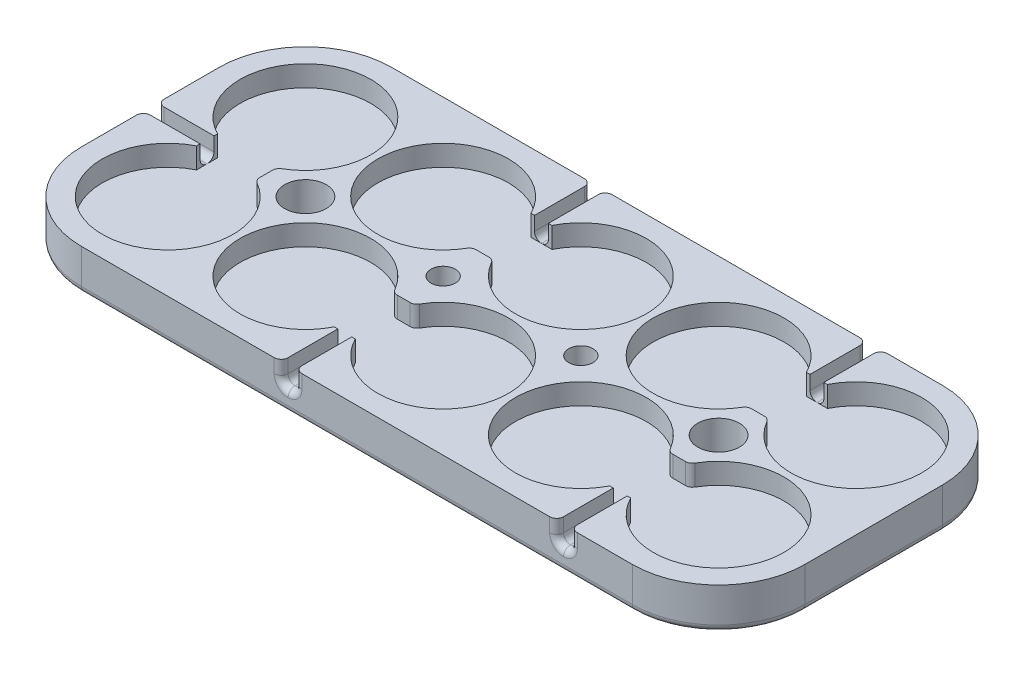
from build123d import *

# Parameters (mm, degrees)
SKETCH2_R               = 9.425
BOSS_EXTRUDE1_DEPTH     = 3
BOSS_EXTRUDE2_START     = -3
SKETCH3_R               = 12.425
BOSS_EXTRUDE2_DEPTH     = 3
SKETCH4_W               = 19.85
SKETCH4_H               = 8.5
SKETCH4_W_2             = 8.5
SKETCH4_H_2             = 19.85
CUT_EXTRUDE1_DEPTH      = 57.793821187
SKETCH5_W               = 2
SKETCH5_H               = 11.675
SKETCH5_W_2             = 11.675
SKETCH5_H_2             = 2
CUT_EXTRUDE2_DEPTH      = 57.793821187
CUT_EXTRUDE3_DEPTH      = 57.793821187
CUT_EXTRUDE3_DEPTH_BACK = 57.793821187
SKETCH7_R               = 3
SKETCH7_R_2             = 1.75
SKETCH8_R               = 3
CUT_EXTRUDE4_DEPTH      = 3.5
FILLET1_R               = 1
FILLET2_R               = 1
CUT_EXTRUDE5_DEPTH      = 0.5


with BuildPart() as part:
    # Sketch2 → Boss-Extrude1 (new body)
    with BuildSketch(Plane(origin=(0, 0, 0), x_dir=(1, 0, 0), z_dir=(0, 1, 0))):
        with BuildLine():
            Line((-39.7, -22.35), (39.7, -22.35))
            ThreePointArc((39.7, -22.35), (48.485801756, -18.710801756), (52.125, -9.925))
            Line((52.125, -9.925), (52.125, 9.925))
            ThreePointArc((52.125, 9.925), (48.485801756, 18.710801756), (39.7, 22.35))
            Line((39.7, 22.35), (-39.7, 22.35))
            ThreePointArc((-39.7, 22.35), (-48.485801756, 18.710801756), (-52.125, 9.925))
            Line((-52.125, 9.925), (-52.125, -9.925))
            ThreePointArc((-52.125, -9.925), (-48.485801756, -18.710801756), (-39.7, -22.35))
        make_face()
        with Locations(Location((-19.85, 9.925, 0), (0, 0, 270))):
            Circle(SKETCH2_R, mode=Mode.SUBTRACT)
        with Locations(Location((-39.7, -9.925, 0), (0, 0, 270))):
            Circle(SKETCH2_R, mode=Mode.SUBTRACT)
        with Locations(Location((-39.7, 9.925, 0), (0, 0, 270))):
            Circle(SKETCH2_R, mode=Mode.SUBTRACT)
        with Locations(Location((-19.85, -9.925, 0), (0, 0, 270))):
            Circle(SKETCH2_R, mode=Mode.SUBTRACT)
        with Locations(Location((19.85, -9.925, 0), (0, 0, 270))):
            Circle(SKETCH2_R, mode=Mode.SUBTRACT)
        with Locations(Location((39.7, 9.925, 0), (0, 0, 270))):
            Circle(SKETCH2_R, mode=Mode.SUBTRACT)
        with Locations(Location((39.7, -9.925, 0), (0, 0, 270))):
            Circle(SKETCH2_R, mode=Mode.SUBTRACT)
        with Locations(Location((19.85, 9.925, 0), (0, 0, 270))):
            Circle(SKETCH2_R, mode=Mode.SUBTRACT)
        with Locations(Location((0, -9.925, 0), (0, 0, 270))):
            Circle(SKETCH2_R, mode=Mode.SUBTRACT)
        with Locations(Location((0, 9.925, 0), (0, 0, 270))):
            Circle(SKETCH2_R, mode=Mode.SUBTRACT)
    extrude(amount=BOSS_EXTRUDE1_DEPTH)

    # Sketch3 → Boss-Extrude2 (add)
    with BuildSketch(Plane(origin=(0, 0, 0), x_dir=(1, 0, 0), z_dir=(0, 1, 0)).offset(BOSS_EXTRUDE2_START)):
        with BuildLine():
            ThreePointArc((-27.275, -9.925), (-30.914198244, -18.710801756), (-39.7, -22.35))
            Line((-39.7, -22.35), (39.700000108, -22.35))
            ThreePointArc((39.700000108, -22.35), (27.916563549, -13.865970744), (32.225041806, 0))
            ThreePointArc((32.225041806, 0), (27.916563532, 13.865970693), (39.7, 22.35))
            Line((39.7, 22.35), (-39.7, 22.35))
            ThreePointArc((-39.7, 22.35), (-30.914198244, 18.710801756), (-27.275, 9.925))
            ThreePointArc((-27.275, 9.925), (-28.581165066, 4.379539269), (-32.225041806, 0))
            ThreePointArc((-32.225041806, 0), (-28.581165066, -4.379539269), (-27.275, -9.925))
        make_face()
        with Locations((-39.7, 9.925)):
            Circle(SKETCH3_R)
        with Locations((-39.7, -9.925)):
            Circle(SKETCH3_R)
        with BuildLine():
            Line((-52.125, 9.924999978), (-52.125, -9.925))
            ThreePointArc((-52.125, -9.925), (-50.818834934, -4.379539269), (-47.174958194, 0))
            ThreePointArc((-47.174958194, 0), (-50.818834929, 4.379539259), (-52.125, 9.924999978))
        make_face()
        with Locations((39.7, -9.925)):
            Circle(SKETCH3_R)
        with Locations((39.7, 9.925)):
            Circle(SKETCH3_R)
        with BuildLine():
            ThreePointArc((47.174958194, 0), (50.818834934, -4.379539269), (52.125, -9.925))
            Line((52.125, -9.925), (52.125, 9.925))
            ThreePointArc((52.125, 9.925), (50.818834934, 4.379539269), (47.174958194, 0))
        make_face()
    extrude(amount=BOSS_EXTRUDE2_DEPTH)

    # Sketch4 → Cut-Extrude1 (cut, through all)
    with BuildSketch(Plane(origin=(0, 0, 0), x_dir=(1, 0, 0), z_dir=(0, 1, 0))):
        with Locations((29.775, -9.925)):
            Rectangle(SKETCH4_W, SKETCH4_H)
        with Locations((-9.925, -9.925)):
            Rectangle(SKETCH4_W, SKETCH4_H)
        with Locations((-39.7, 0)):
            Rectangle(SKETCH4_W_2, SKETCH4_H_2)
        with Locations((-9.925, 9.925)):
            Rectangle(SKETCH4_W, SKETCH4_H)
        with Locations((29.775, 9.925)):
            Rectangle(SKETCH4_W, SKETCH4_H)
    extrude(amount=CUT_EXTRUDE1_DEPTH, mode=Mode.SUBTRACT)

    # Sketch5 → Cut-Extrude2 (cut, through all)
    with BuildSketch(Plane(origin=(0, 0, 0), x_dir=(1, 0, 0), z_dir=(0, 1, 0))):
        with Locations((-9.925, 16.5125)):
            Rectangle(SKETCH5_W, SKETCH5_H)
        with Locations((29.775, 16.5125)):
            Rectangle(SKETCH5_W, SKETCH5_H)
        with Locations((29.775, -16.5125)):
            Rectangle(SKETCH5_W, SKETCH5_H)
        with Locations((-9.925, -16.5125)):
            Rectangle(SKETCH5_W, SKETCH5_H)
        with Locations((-46.2875, 0)):
            Rectangle(SKETCH5_W_2, SKETCH5_H_2)
    extrude(amount=CUT_EXTRUDE2_DEPTH, mode=Mode.SUBTRACT)

    # Sketch7 → Cut-Extrude3 (cut, two sides: drawn at the far end of the back side and taken through both)
    with BuildSketch(Plane(origin=(0, 0, 0), x_dir=(1, 0, 0), z_dir=(0, 1, 0)).offset(-CUT_EXTRUDE3_DEPTH_BACK)):
        with Locations(Location((-29.775, 0, 0), (0, 0, 270))):
            Circle(SKETCH7_R)
        with Locations(Location((-9.925, 0, 0), (0, 0, 270))):
            Circle(SKETCH7_R_2)
        with Locations(Location((9.925, 0, 0), (0, 0, 270))):
            Circle(SKETCH7_R_2)
        with Locations(Location((29.775, 0, 0), (0, 0, 270))):
            Circle(SKETCH7_R)
    extrude(amount=CUT_EXTRUDE3_DEPTH + CUT_EXTRUDE3_DEPTH_BACK, mode=Mode.SUBTRACT)

    # Sketch8 → Cut-Extrude4 (cut)
    with BuildSketch(Plane.XZ.offset(3)):
        with Locations(Location((9.925, 0, 0), (0, 0, 270))):
            Circle(SKETCH8_R)
        with Locations(Location((-9.925, 0, 0), (0, 0, 270))):
            Circle(SKETCH8_R)
    extrude(amount=-CUT_EXTRUDE4_DEPTH, mode=Mode.SUBTRACT)

    # Fillet1
    fillet1_edges = [part.edges().sort_by_distance(p)[0] for p in [
        (28.775, 0, 18.2625),
        (30.775, 0, 18.2625),
        (-8.925, 0, 18.2625),
        (-10.925, 0, 18.2625),
        (-48.0375, 0, 1),
        (-48.0375, 0, -1),
        (-10.925, 0, -18.2625),
        (-8.925, 0, -18.2625),
        (28.775, 0, -18.2625),
        (30.775, 0, -18.2625),
    ]]
    fillet(fillet1_edges, radius=FILLET1_R - 0.0001)  # a hair under: the kernel refuses the full size
    fillet1_2_edges = [part.edges().sort_by_distance(p)[0] for p in [
        (28.775, 1.99995, 22.35),
        (30.775, 1.99995, 22.35),
        (-10.925, 1.99995, 22.35),
        (-8.925, 1.99995, 22.35),
        (-52.125, 1.99995, 1),
        (-52.125, 1.99995, -1),
        (-8.925, 1.99995, -22.35),
        (-10.925, 1.99995, -22.35),
        (30.775, 1.99995, -22.35),
        (28.775, 1.99995, -22.35),
        (28.262379271, 1.5, 5.675),
        (31.287620729, 1.5, 5.675),
        (-8.412379271, 1.5, 5.675),
        (-11.437620729, 1.5, 5.675),
        (-35.45, 1.5, -1.512620729),
        (-35.45, 1.5, 1.512620729),
        (-11.437620729, 1.5, -5.675),
        (-8.412379271, 1.5, -5.675),
        (28.262379271, 1.5, -5.675),
        (31.287620729, 1.5, -5.675),
        (29.067863929, 0.292863929, -22.35),
        (30.482136071, 0.292863929, -22.35),
        (-10.632136071, 0.292863929, -22.35),
        (-9.217863929, 0.292863929, -22.35),
        (-52.125, 0.292863929, -0.707136071),
        (-52.125, 0.292863929, 0.707136071),
        (-9.217863929, 0.292863929, 22.35),
        (-10.632136071, 0.292863929, 22.35),
        (30.482136071, 0.292863929, 22.35),
        (29.067863929, 0.292863929, 22.35),
    ]]
    fillet(fillet1_2_edges, radius=FILLET1_R)

    # Fillet2
    fillet2_edges = [part.edges().sort_by_distance(p)[0] for p in [
        (48.485801794, -3, 18.710801718),
        (5.4e-08, -3, 22.35),
        (-48.485801756, -3, 18.710801756),
        (-48.485801764, -3, -18.710801748),
        (48.485801756, -3, -18.710801756),
        (52.125, -3, 0),
        (-52.125, -3, 1.1e-08),
        (0, -3, -22.35),
    ]]
    fillet(fillet2_edges, radius=FILLET2_R)

    # Sketch9 → Cut-Extrude5 (cut)
    # profile 1 of 10: a face of its own
    with BuildSketch(Plane.XZ.offset(3)):
        Polygon((-41.93125, -3.371875), (-41.93125, -1.990625), (-40.30625, -1.990625), (-40.30625, -0.379589844), (-39.0875, -0.379589844), (-39.0875, -1.990625), (-37.4625, -1.990625), (-37.4625, -3.371875), (-39.0875, -3.371875), (-39.0875, -4.990527344), (-40.30625, -4.990527344), (-40.30625, -3.371875), align=None)
    # profile 2 of 10: a face of its own
    with BuildSketch(Plane.XZ.offset(3)):
        with BuildLine():
            Line((-37.70625, 1.155273438), (-37.70625, 3.003710938))
            Line((-37.70625, 3.003710938), (-38.913574219, 3.2296875))
            add(Edge.make_bspline(
                [(-38.913574219, 3.2296875), (-38.888354447, 3.195004202), (-38.838357858, 3.126246777), (-38.775816936, 3.016215044), (-38.719833196, 2.904684269), (-38.67723522, 2.78804962), (-38.642859865, 2.668424819), (-38.616912947, 2.545512106), (-38.603260829, 2.418768552), (-38.601095778, 2.333427364), (-38.6, 2.290234375)],
                knots=[0, 0, 0, 0, 1.019769699, 2.021628385, 3.008030164, 3.986378705, 4.97133988, 5.968784958, 6.971958885, 8, 8, 8, 8], degree=3))
            add(Edge.make_bspline(
                [(-38.6, 2.290234375), (-38.601776673, 2.216478332), (-38.605285814, 2.070801375), (-38.638472169, 1.856507366), (-38.690195164, 1.649702893), (-38.762963563, 1.451812524), (-38.852441456, 1.264849333), (-38.957887633, 1.090464117), (-39.076393572, 0.928545879), (-39.212214447, 0.783101653), (-39.357772298, 0.650132327), (-39.515952873, 0.534442847), (-39.684877452, 0.434760373), (-39.863331803, 0.35124336), (-40.050292843, 0.284690145), (-40.244416524, 0.238412025), (-40.444476066, 0.207371634), (-40.580350356, 0.204550731), (-40.649023437, 0.203125)],
                knots=[0, 0, 0, 0, 1.08625284, 2.145478562, 3.187603353, 4.223364536, 5.24703985, 6.237405749, 7.222752121, 8.198101564, 9.165041285, 10.124227595, 11.080388489, 12.051261812, 13.023656128, 13.999244784, 14.988785689, 16, 16, 16, 16], degree=3))
            add(Edge.make_bspline(
                [(-40.649023437, 0.203125), (-40.748287249, 0.206500481), (-40.943979002, 0.213155008), (-41.230986695, 0.267278708), (-41.506409805, 0.353523058), (-41.724281776, 0.45550631), (-41.89025101, 0.553052891), (-42.00877063, 0.636245926), (-42.121501816, 0.727539988), (-42.228798042, 0.826832695), (-42.329203199, 0.935167651), (-42.423474592, 1.052200786), (-42.510461285, 1.178515088), (-42.59360878, 1.311000229), (-42.666782038, 1.451604635), (-42.730391319, 1.598533193), (-42.78537166, 1.751002104), (-42.829267075, 1.909391367), (-42.864081019, 2.073003985), (-42.887445682, 2.242319957), (-42.903514638, 2.417302861), (-42.905330585, 2.536063056), (-42.90625, 2.596191406)],
                knots=[0, 0, 0, 0, 1.614845366, 3.183556158, 4.736945776, 6.3025528, 7.087021627, 7.868642129, 8.657243818, 9.446897877, 10.24628748, 11.059624568, 11.890909107, 12.741604561, 13.604347575, 14.468189976, 15.346307227, 16.240516445, 17.141677189, 18.067180109, 19.021412259, 20, 20, 20, 20], degree=3))
            add(Edge.make_bspline(
                [(-42.90625, 2.596191406), (-42.905064552, 2.659260334), (-42.902739024, 2.782984469), (-42.890746152, 2.964073511), (-42.867733633, 3.136163094), (-42.835714553, 3.298786798), (-42.797210898, 3.453224783), (-42.7475896, 3.597878655), (-42.688840905, 3.733654406), (-42.600751388, 3.898698676), (-42.478712582, 4.084235441), (-42.318070744, 4.276878388), (-42.146291593, 4.435985956), (-41.963119588, 4.555142779), (-41.780882792, 4.643988216), (-41.608320574, 4.710093255), (-41.445241965, 4.751180813), (-41.339428964, 4.756791595), (-41.288867188, 4.759472656)],
                knots=[0, 0, 0, 0, 1.013582185, 1.988373401, 2.914513124, 3.801374318, 4.650762859, 5.470085016, 6.255844122, 7.025459743, 8.473948101, 9.815657502, 11.047961438, 12.221074907, 13.312848151, 14.300551696, 15.187934143, 16, 16, 16, 16], degree=3))
            add(Edge.make_bspline(
                [(-41.288867188, 4.759472656), (-41.256500223, 4.757413713), (-41.191716453, 4.753292656), (-41.096203093, 4.722540138), (-41.005743276, 4.669822799), (-40.919535264, 4.601596699), (-40.844409247, 4.518029499), (-40.7904347, 4.420306725), (-40.755243869, 4.312855213), (-40.752163764, 4.237130747), (-40.750585937, 4.198339844)],
                knots=[0, 0, 0, 0, 0.904042773, 1.809477692, 2.773527107, 3.817381096, 4.873497324, 5.890390631, 6.919323454, 8, 8, 8, 8], degree=3))
            add(Edge.make_bspline(
                [(-40.750585937, 4.198339844), (-40.752154462, 4.159744719), (-40.755176802, 4.085377018), (-40.775458965, 3.977739743), (-40.811256871, 3.879239982), (-40.861353473, 3.789210338), (-40.92534359, 3.70820298), (-41.004961529, 3.637613685), (-41.097666395, 3.575222495), (-41.166930612, 3.542375029), (-41.202539063, 3.525488281)],
                knots=[0, 0, 0, 0, 1.070872181, 2.063429057, 3.025512209, 3.966438538, 4.910875251, 5.875320226, 6.907710805, 8, 8, 8, 8], degree=3))
            add(Edge.make_bspline(
                [(-41.202539063, 3.525488281), (-41.261732716, 3.496869957), (-41.375089147, 3.442065584), (-41.525854614, 3.340448049), (-41.653944646, 3.23126204), (-41.756104899, 3.111247627), (-41.834498163, 2.984668147), (-41.889660873, 2.853536704), (-41.924574856, 2.718175964), (-41.929016786, 2.626019738), (-41.93125, 2.5796875)],
                knots=[0, 0, 0, 0, 1.246173256, 2.38643411, 3.439441567, 4.430594302, 5.364333449, 6.253179032, 7.121772564, 8, 8, 8, 8], degree=3))
            add(Edge.make_bspline(
                [(-41.93125, 2.5796875), (-41.929949637, 2.53083351), (-41.927425054, 2.435986163), (-41.895947262, 2.299075778), (-41.85020936, 2.171205783), (-41.78262806, 2.054271989), (-41.698641709, 1.949177595), (-41.599342386, 1.854825097), (-41.484420918, 1.773920323), (-41.355351723, 1.705043174), (-41.213794743, 1.650695799), (-41.061382418, 1.613637776), (-40.900407726, 1.587957318), (-40.78962488, 1.585589355), (-40.7328125, 1.584375)],
                knots=[0, 0, 0, 0, 1.004414075, 1.950014914, 2.879565473, 3.793282912, 4.717750338, 5.642751983, 6.605517642, 7.603974128, 8.649867825, 9.719756986, 10.830630925, 12, 12, 12, 12], degree=3))
            add(Edge.make_bspline(
                [(-40.7328125, 1.584375), (-40.672223282, 1.586183284), (-40.555615568, 1.58966344), (-40.387547428, 1.613329623), (-40.233992195, 1.655235913), (-40.094919341, 1.713604175), (-39.971823569, 1.786307292), (-39.863429357, 1.868611369), (-39.773237248, 1.964001127), (-39.700930381, 2.069857725), (-39.644578647, 2.184174186), (-39.604035406, 2.304952897), (-39.578874181, 2.432228716), (-39.576305455, 2.51905667), (-39.575, 2.563183594)],
                knots=[0, 0, 0, 0, 1.27823599, 2.46004456, 3.571179967, 4.627444697, 5.631916714, 6.58018035, 7.489612449, 8.38855397, 9.274949741, 10.169936726, 11.069941664, 12, 12, 12, 12], degree=3))
            add(Edge.make_bspline(
                [(-39.575, 2.563183594), (-39.575271785, 2.609800224), (-39.575772414, 2.69566841), (-39.590472202, 2.813171966), (-39.609477648, 2.910222396), (-39.645019257, 2.991622727), (-39.697867096, 3.071063721), (-39.76276327, 3.170276159), (-39.851266145, 3.292073184), (-39.956547873, 3.429253872), (-40.058691479, 3.576019475), (-40.134617241, 3.725040571), (-40.183308124, 3.868655764), (-40.190031034, 3.963569179), (-40.193261719, 4.009179688)],
                knots=[0, 0, 0, 0, 1.040838944, 1.917233242, 2.644627811, 3.242022575, 3.887710035, 4.774405358, 5.892648842, 7.250913045, 8.641303185, 9.880711888, 10.98157908, 12, 12, 12, 12], degree=3))
            add(Edge.make_bspline(
                [(-40.193261719, 4.009179688), (-40.191621724, 4.048377277), (-40.188386183, 4.125710094), (-40.153057046, 4.236760628), (-40.098712453, 4.340473578), (-40.024620072, 4.434299595), (-39.935957371, 4.512586522), (-39.839553004, 4.573757691), (-39.734399746, 4.609365368), (-39.662000643, 4.613798063), (-39.62578125, 4.616015625)],
                knots=[0, 0, 0, 0, 1.023616867, 2.019490913, 3.021024079, 4.078760992, 5.130907536, 6.10614948, 7.052555734, 8, 8, 8, 8], degree=3))
            add(Edge.make_bspline(
                [(-39.62578125, 4.616015625), (-39.615186891, 4.615300431), (-39.584519577, 4.613230172), (-39.524661358, 4.602624129), (-39.435610549, 4.589573573), (-39.366762869, 4.577314252), (-39.327441406, 4.5703125)],
                knots=[0, 0, 0, 0, 0.421823084, 1.221044272, 2.412835351, 4, 4, 4, 4], degree=3))
            Line((-39.327441406, 4.5703125), (-37.317773438, 4.217382813))
            add(Edge.make_bspline(
                [(-37.317773438, 4.217382813), (-37.258132131, 4.205820351), (-37.145079254, 4.183903165), (-36.990111419, 4.128784716), (-36.858236368, 4.061045553), (-36.74940187, 3.975646089), (-36.665980854, 3.866331322), (-36.607857209, 3.732452168), (-36.574078383, 3.572413006), (-36.570608649, 3.457533915), (-36.56875, 3.395996094)],
                knots=[0, 0, 0, 0, 1.170661162, 2.219042838, 3.16128212, 4.020649716, 4.864876015, 5.785830123, 6.813925249, 8, 8, 8, 8], degree=3))
            Line((-36.56875, 3.395996094), (-36.56875, 1.180664063))
            add(Edge.make_bspline(
                [(-36.56875, 1.180664063), (-36.570244509, 1.117513411), (-36.573048509, 0.999030018), (-36.598922153, 0.832998107), (-36.64375982, 0.692019237), (-36.706355812, 0.574658767), (-36.788915033, 0.482526216), (-36.892263991, 0.418924186), (-37.012415083, 0.37938413), (-37.098664246, 0.375353642), (-37.143847656, 0.373242188)],
                knots=[0, 0, 0, 0, 1.344730686, 2.522986704, 3.56640363, 4.482312437, 5.337369367, 6.167786367, 7.040156946, 8, 8, 8, 8], degree=3))
            add(Edge.make_bspline(
                [(-37.143847656, 0.373242188), (-37.180989021, 0.375686162), (-37.254619477, 0.380531191), (-37.360219201, 0.419751035), (-37.457465456, 0.48256755), (-37.545357459, 0.569473642), (-37.618804015, 0.681827257), (-37.669899338, 0.81959761), (-37.701705498, 0.979902254), (-37.704677532, 1.094592318), (-37.70625, 1.155273438)],
                knots=[0, 0, 0, 0, 0.826265408, 1.638019978, 2.478174968, 3.392219469, 4.373568936, 5.445905295, 6.648659502, 8, 8, 8, 8], degree=3))
        make_face()
    # profile 3 of 10: a face of its own
    with BuildSketch(Plane.XZ.offset(3)):
        with BuildLine():
            add(Edge.make_bspline(
                [(-12.644335938, -9.15), (-12.586589295, -9.147582359), (-12.474091138, -9.142872472), (-12.311915745, -9.105572296), (-12.163347415, -9.042279828), (-12.051384837, -8.969371804), (-11.97217234, -8.898824265), (-11.919560064, -8.840473608), (-11.876227225, -8.776085445), (-11.840068951, -8.706791468), (-11.812515968, -8.631604667), (-11.791864361, -8.551305474), (-11.780599872, -8.465197797), (-11.779225011, -8.406085877), (-11.778515625, -8.375585937)],
                knots=[0, 0, 0, 0, 1.588922051, 3.095431968, 4.55195291, 6.015911772, 6.750344642, 7.468325924, 8.172850126, 8.881601128, 9.615294202, 10.372660857, 11.160342861, 12, 12, 12, 12], degree=3))
            add(Edge.make_bspline(
                [(-11.778515625, -8.375585937), (-11.780940094, -8.330052772), (-11.785691884, -8.240810968), (-11.823822553, -8.112128419), (-11.887968431, -7.994282978), (-11.975196924, -7.887981674), (-12.084712501, -7.79845234), (-12.214276886, -7.732478802), (-12.362858552, -7.693877677), (-12.467635013, -7.689690832), (-12.522460938, -7.6875)],
                knots=[0, 0, 0, 0, 0.962640342, 1.886707414, 2.812509498, 3.786255046, 4.779539858, 5.785068332, 6.841002323, 8, 8, 8, 8], degree=3))
            add(Edge.make_bspline(
                [(-12.522460938, -7.6875), (-12.555893358, -7.68845483), (-12.61907575, -7.690259319), (-12.709115615, -7.69763789), (-12.787914773, -7.716240426), (-12.878015535, -7.745225047), (-12.97626107, -7.799416903), (-13.055833756, -7.876336891), (-13.111969883, -7.95019182), (-13.154385131, -8.017107139), (-13.197730261, -8.095880701), (-13.256803449, -8.212651726), (-13.323681873, -8.361985016), (-13.377636746, -8.480143129), (-13.403515625, -8.536816406)],
                knots=[0, 0, 0, 0, 0.904989055, 1.710297113, 2.437899308, 3.089491427, 4.268063784, 5.434116808, 6.054598845, 6.775415668, 7.574844294, 8.486110305, 10.314600321, 12, 12, 12, 12], degree=3))
            add(Edge.make_bspline(
                [(-13.403515625, -8.536816406), (-13.41302027, -8.550954521), (-13.433325345, -8.581158224), (-13.480679061, -8.616863538), (-13.53823644, -8.65334666), (-13.635298497, -8.695971687), (-13.774075258, -8.737657299), (-13.891485891, -8.742516838), (-13.951953125, -8.745019531)],
                knots=[0, 0, 0, 0, 0.502291102, 1.073060463, 1.738596173, 2.525307356, 4.210510845, 6, 6, 6, 6], degree=3))
            add(Edge.make_bspline(
                [(-13.951953125, -8.745019531), (-13.985181842, -8.743021688), (-14.05125056, -8.739049373), (-14.147115058, -8.708183309), (-14.237720225, -8.658484248), (-14.321772836, -8.591107602), (-14.393069129, -8.505978915), (-14.44641057, -8.406492568), (-14.477340641, -8.29318124), (-14.480814633, -8.213700964), (-14.482617188, -8.172460937)],
                knots=[0, 0, 0, 0, 0.917417596, 1.824103036, 2.756029669, 3.762874785, 4.784566943, 5.805253663, 6.861209319, 8, 8, 8, 8], degree=3))
            add(Edge.make_bspline(
                [(-14.482617188, -8.172460937), (-14.480891173, -8.132528572), (-14.477383604, -8.051378903), (-14.448459629, -7.929611354), (-14.405467507, -7.8058502), (-14.34381658, -7.681113715), (-14.26473047, -7.557513354), (-14.171106846, -7.435350375), (-14.060202835, -7.31851195), (-13.936593493, -7.203785781), (-13.795657962, -7.096812922), (-13.637030341, -7.002319984), (-13.464000624, -6.916237398), (-13.274759035, -6.845389665), (-13.073394321, -6.784443617), (-12.859338609, -6.743803327), (-12.635255664, -6.717570556), (-12.48233597, -6.714211879), (-12.404394531, -6.7125)],
                knots=[0, 0, 0, 0, 0.687665124, 1.397457831, 2.147322746, 2.943422878, 3.789436066, 4.673713908, 5.592469244, 6.563166905, 7.578694088, 8.635921147, 9.741960392, 10.905797436, 12.115380376, 13.36442633, 14.656677908, 16, 16, 16, 16], degree=3))
            add(Edge.make_bspline(
                [(-12.404394531, -6.7125), (-12.331976646, -6.713946261), (-12.189731242, -6.716787052), (-11.980687817, -6.73965201), (-11.780982322, -6.779540097), (-11.590535658, -6.832216833), (-11.410781888, -6.899680252), (-11.243389169, -6.980240325), (-11.089083863, -7.075320499), (-10.949347977, -7.1827752), (-10.823235744, -7.299028235), (-10.714381777, -7.424024122), (-10.623515778, -7.557147123), (-10.549904588, -7.697058206), (-10.492481757, -7.842254448), (-10.451615223, -7.992064305), (-10.426776393, -8.145810148), (-10.424032102, -8.249811808), (-10.42265625, -8.301953125)],
                knots=[0, 0, 0, 0, 1.225107078, 2.406392441, 3.552210207, 4.667510872, 5.746030394, 6.796375209, 7.805802999, 8.80681598, 9.774471105, 10.703308983, 11.604924289, 12.495296676, 13.372823065, 14.241306182, 15.118277406, 16, 16, 16, 16], degree=3))
            add(Edge.make_bspline(
                [(-10.42265625, -8.301953125), (-10.424528504, -8.369851517), (-10.428160533, -8.501569149), (-10.465660085, -8.692165283), (-10.522577058, -8.869952115), (-10.607625328, -9.033167057), (-10.712010729, -9.184047461), (-10.830902664, -9.329289585), (-10.967621203, -9.466021724), (-11.0693556, -9.548659594), (-11.120898438, -9.590527344)],
                knots=[0, 0, 0, 0, 1.068493578, 2.072794954, 3.049015524, 4.000257127, 4.960059425, 5.935847279, 6.954215185, 8, 8, 8, 8], degree=3))
            add(Edge.make_bspline(
                [(-11.120898438, -9.590527344), (-11.073819925, -9.615015052), (-10.978805602, -9.66443639), (-10.845138981, -9.755692998), (-10.715983066, -9.857286426), (-10.595279046, -9.971008871), (-10.484142726, -10.092673), (-10.387383491, -10.220868252), (-10.306045467, -10.354211158), (-10.241884761, -10.493058001), (-10.190227221, -10.635576958), (-10.154840857, -10.783353503), (-10.132702947, -10.935559307), (-10.129659072, -11.038987093), (-10.128125, -11.091113281)],
                knots=[0, 0, 0, 0, 1.00625233, 2.030828509, 3.065551735, 4.122322673, 5.174108021, 6.189198351, 7.165688209, 8.132120304, 9.087207882, 10.037726527, 11.011041016, 12, 12, 12, 12], degree=3))
            add(Edge.make_bspline(
                [(-10.128125, -11.091113281), (-10.130165435, -11.153857543), (-10.134254184, -11.279588373), (-10.164851929, -11.467112668), (-10.212933262, -11.653559573), (-10.281611942, -11.836816833), (-10.36876837, -12.015409852), (-10.478256887, -12.184715338), (-10.605042559, -12.346900444), (-10.753082013, -12.497534547), (-10.917650561, -12.636910806), (-11.098951514, -12.762792432), (-11.298711082, -12.869801858), (-11.512416632, -12.964270628), (-11.741083876, -13.039260491), (-11.982716003, -13.091830008), (-12.235816717, -13.126400745), (-12.40893251, -13.129614031), (-12.497070313, -13.13125)],
                knots=[0, 0, 0, 0, 0.865116607, 1.733574129, 2.614147439, 3.517277987, 4.42829596, 5.349596062, 6.293093627, 7.26308448, 8.257066179, 9.264123562, 10.301066281, 11.377915821, 12.483550515, 13.613627803, 14.785035159, 16, 16, 16, 16], degree=3))
            add(Edge.make_bspline(
                [(-12.497070313, -13.13125), (-12.582258819, -13.1292133), (-12.748282205, -13.125243988), (-12.990682235, -13.089653256), (-13.219627024, -13.033731426), (-13.433347684, -12.952671051), (-13.630294318, -12.855248796), (-13.810645858, -12.745333356), (-13.973988485, -12.625347517), (-14.117587596, -12.492712119), (-14.24247209, -12.352446913), (-14.353739821, -12.210578569), (-14.448395192, -12.06544214), (-14.524850341, -11.919096321), (-14.585562014, -11.777627316), (-14.628600317, -11.645418812), (-14.658209738, -11.525314873), (-14.662258651, -11.448418021), (-14.664160156, -11.412304687)],
                knots=[0, 0, 0, 0, 1.352749266, 2.636365181, 3.883815623, 5.090148188, 6.259800183, 7.370213415, 8.4419304, 9.474464176, 10.469453221, 11.422962127, 12.336745574, 13.217916145, 14.043357411, 14.779004771, 15.426579817, 16, 16, 16, 16], degree=3))
            add(Edge.make_bspline(
                [(-14.664160156, -11.412304687), (-14.662172628, -11.368453451), (-14.658323528, -11.28353), (-14.622672954, -11.163488813), (-14.56638764, -11.055769392), (-14.484751919, -10.966377968), (-14.388546694, -10.892394923), (-14.2790546, -10.83845913), (-14.158667768, -10.805491726), (-14.074886988, -10.802119516), (-14.031933594, -10.800390625)],
                knots=[0, 0, 0, 0, 1.065566147, 2.063603226, 3.022673671, 4.000932909, 4.986224236, 5.963342773, 6.955830415, 8, 8, 8, 8], degree=3))
            add(Edge.make_bspline(
                [(-14.031933594, -10.800390625), (-14.002666143, -10.801794939), (-13.944940466, -10.804564739), (-13.859637005, -10.821158405), (-13.777774135, -10.8509411), (-13.701486485, -10.891149907), (-13.632936946, -10.934969535), (-13.578485452, -10.981272974), (-13.534325129, -11.024673782), (-13.518660916, -11.058832037), (-13.511425781, -11.074609375)],
                knots=[0, 0, 0, 0, 1.143080217, 2.2545551, 3.37824436, 4.53107536, 5.617207074, 6.543824975, 7.327408127, 8, 8, 8, 8], degree=3))
            add(Edge.make_bspline(
                [(-13.511425781, -11.074609375), (-13.493041362, -11.122097691), (-13.457404333, -11.214150774), (-13.401927923, -11.346010299), (-13.345763034, -11.466328867), (-13.29172731, -11.576773209), (-13.235203198, -11.6750464), (-13.181814235, -11.764974702), (-13.125113347, -11.841893222), (-13.054741228, -11.931334098), (-12.954113549, -12.022334233), (-12.814752565, -12.101141399), (-12.656618949, -12.148412233), (-12.545641587, -12.153576319), (-12.488183594, -12.15625)],
                knots=[0, 0, 0, 0, 1.14566123, 2.220791496, 3.217566238, 4.132996771, 4.985623846, 5.767776728, 6.483862468, 7.133650454, 8.326789082, 9.507709648, 10.709628707, 12, 12, 12, 12], degree=3))
            add(Edge.make_bspline(
                [(-12.488183594, -12.15625), (-12.448300098, -12.154729556), (-12.368801488, -12.151698901), (-12.250871417, -12.128832993), (-12.134930035, -12.093974393), (-12.023232757, -12.042277543), (-11.916028678, -11.978677821), (-11.819172411, -11.897082806), (-11.730919734, -11.802753836), (-11.653670977, -11.694442543), (-11.588274185, -11.574960451), (-11.543253331, -11.443981752), (-11.513744329, -11.305288594), (-11.510852799, -11.209760075), (-11.509375, -11.1609375)],
                knots=[0, 0, 0, 0, 0.9235703, 1.840925773, 2.774487623, 3.722307052, 4.685870479, 5.653814215, 6.645891586, 7.671748793, 8.728990655, 9.789591876, 10.870307882, 12, 12, 12, 12], degree=3))
            add(Edge.make_bspline(
                [(-11.509375, -11.1609375), (-11.510091901, -11.124517442), (-11.511496046, -11.053183981), (-11.522828816, -10.949515094), (-11.542207581, -10.851935402), (-11.567765494, -10.760324999), (-11.604775505, -10.676149231), (-11.645748341, -10.596352767), (-11.69733079, -10.524400137), (-11.754566009, -10.457502539), (-11.818936391, -10.398325553), (-11.889871925, -10.346414914), (-11.967438737, -10.303876292), (-12.050988525, -10.267520217), (-12.14098662, -10.240316422), (-12.237255457, -10.219368675), (-12.339816825, -10.208461465), (-12.410296933, -10.206997569), (-12.446289063, -10.20625)],
                knots=[0, 0, 0, 0, 1.150351983, 2.253115219, 3.288686571, 4.291290674, 5.249697225, 6.188606808, 7.119488109, 8.038778818, 8.965909071, 9.87503508, 10.808600146, 11.754714714, 12.748366816, 13.773531894, 14.86300785, 16, 16, 16, 16], degree=3))
            add(Edge.make_bspline(
                [(-12.446289063, -10.20625), (-12.460254765, -10.206642324), (-12.49285208, -10.207558046), (-12.548752242, -10.209994192), (-12.61857927, -10.21531837), (-12.696824057, -10.222601441), (-12.774190493, -10.230212325), (-12.840640671, -10.235383631), (-12.89230315, -10.237926815), (-12.921515898, -10.238864051), (-12.933789063, -10.239257812)],
                knots=[0, 0, 0, 0, 0.68607079, 1.601356213, 2.747301521, 4.124469278, 5.460252047, 6.564749978, 7.397007756, 8, 8, 8, 8], degree=3))
            add(Edge.make_bspline(
                [(-12.933789063, -10.239257812), (-12.975846491, -10.237765763), (-13.055830253, -10.234928222), (-13.168720226, -10.207809289), (-13.267539034, -10.163103444), (-13.351342723, -10.100026347), (-13.418962978, -10.020620385), (-13.463938887, -9.924797924), (-13.495195455, -9.817607125), (-13.49751724, -9.741004578), (-13.498730469, -9.700976562)],
                knots=[0, 0, 0, 0, 1.139920524, 2.167872241, 3.128901249, 4.063837875, 4.993255263, 5.928121337, 6.917357245, 8, 8, 8, 8], degree=3))
            add(Edge.make_bspline(
                [(-13.498730469, -9.700976562), (-13.49666334, -9.661349631), (-13.492671947, -9.584834472), (-13.45806842, -9.476497656), (-13.402742805, -9.379777376), (-13.322942069, -9.298238), (-13.224463881, -9.229088442), (-13.103460648, -9.183970858), (-12.965778022, -9.153464922), (-12.867544345, -9.151196612), (-12.815722656, -9.15)],
                knots=[0, 0, 0, 0, 0.958765127, 1.851267899, 2.72949922, 3.636745432, 4.595949755, 5.623009295, 6.746054562, 8, 8, 8, 8], degree=3))
            Line((-12.815722656, -9.15), (-12.644335938, -9.15))
        make_face()
    # profile 4 of 10: a face of its own
    with BuildSketch(Plane.XZ.offset(3)):
        Polygon((-6.471875, -12.15625), (-7.853125, -12.15625), (-7.853125, -10.53125), (-9.464160156, -10.53125), (-9.464160156, -9.3125), (-7.853125, -9.3125), (-7.853125, -7.6875), (-6.471875, -7.6875), (-6.471875, -9.3125), (-4.853222656, -9.3125), (-4.853222656, -10.53125), (-6.471875, -10.53125), align=None)
    # profile 5 of 10: a face of its own
    with BuildSketch(Plane.XZ.offset(3)):
        with BuildLine():
            Line((27.053125, -12.374609375), (27.053125, -8.6625))
            add(Edge.make_bspline(
                [(27.053125, -8.6625), (26.979944455, -8.726509359), (26.840597494, -8.848392978), (26.634719199, -9.014058908), (26.443220829, -9.154540992), (26.265760468, -9.269291534), (26.103242331, -9.359552976), (25.955287695, -9.424191534), (25.821400492, -9.466001372), (25.735587296, -9.472159059), (25.695996094, -9.475)],
                knots=[0, 0, 0, 0, 1.452107273, 2.765034543, 3.945897232, 4.997908399, 5.920070119, 6.718510474, 7.408765629, 8, 8, 8, 8], degree=3))
            add(Edge.make_bspline(
                [(25.695996094, -9.475), (25.661464927, -9.473171665), (25.59352586, -9.469574468), (25.495461534, -9.436862989), (25.404060141, -9.385215137), (25.321817552, -9.314623785), (25.251979548, -9.230899408), (25.202110268, -9.136470935), (25.169583554, -9.035729467), (25.165916009, -8.965741645), (25.1640625, -8.930371094)],
                knots=[0, 0, 0, 0, 0.982678269, 1.933390929, 2.917255113, 3.962257531, 5.008793131, 6.008019064, 6.993289668, 8, 8, 8, 8], degree=3))
            add(Edge.make_bspline(
                [(25.1640625, -8.930371094), (25.166036929, -8.890862814), (25.169766361, -8.816236945), (25.196640189, -8.712076953), (25.246535437, -8.625675278), (25.319120664, -8.55687971), (25.413276608, -8.497522375), (25.527120001, -8.432096549), (25.664722355, -8.359137261), (25.765997691, -8.312028824), (25.820410156, -8.28671875)],
                knots=[0, 0, 0, 0, 0.959800551, 1.812935176, 2.587130183, 3.350598702, 4.217563363, 5.286346087, 6.542028024, 8, 8, 8, 8], degree=3))
            add(Edge.make_bspline(
                [(25.820410156, -8.28671875), (25.89961768, -8.248313814), (26.051674652, -8.174586749), (26.262901123, -8.053188612), (26.450881492, -7.931219543), (26.614380281, -7.801801527), (26.761694496, -7.666615362), (26.899649196, -7.525567274), (27.028451693, -7.374269813), (27.145986867, -7.220314252), (27.248850919, -7.075366727), (27.338586235, -6.956674274), (27.40876611, -6.867865348), (27.461517536, -6.80130718), (27.519543306, -6.757051608), (27.591933847, -6.730303434), (27.681689479, -6.714494009), (27.747478695, -6.713200482), (27.783105469, -6.7125)],
                knots=[0, 0, 0, 0, 1.633066382, 3.135044738, 4.518110351, 5.78750681, 6.999314836, 8.226621731, 9.446368142, 10.684082489, 11.819758467, 12.744847819, 13.443941736, 13.922653104, 14.315303366, 14.780490369, 15.339600077, 16, 16, 16, 16], degree=3))
            add(Edge.make_bspline(
                [(27.783105469, -6.7125), (27.833749765, -6.714564687), (27.930416845, -6.71850565), (28.065900969, -6.758521443), (28.181423821, -6.825851364), (28.273386882, -6.920066276), (28.34506961, -7.030804805), (28.398285197, -7.154696051), (28.428994833, -7.291614602), (28.432541708, -7.386888225), (28.434375, -7.436132812)],
                knots=[0, 0, 0, 0, 1.104026993, 2.107306726, 3.052283825, 3.993636142, 4.95520013, 5.920268712, 6.92503816, 8, 8, 8, 8], degree=3))
            Line((28.434375, -7.436132812), (28.434375, -12.212109375))
            add(Edge.make_bspline(
                [(28.434375, -12.212109375), (28.432498372, -12.284208438), (28.428974174, -12.419606243), (28.395121664, -12.608495934), (28.339018113, -12.770048877), (28.256877173, -12.902697244), (28.15071227, -13.007504376), (28.020097367, -13.080544827), (27.866749757, -13.12493469), (27.75719241, -13.129067013), (27.699316406, -13.13125)],
                knots=[0, 0, 0, 0, 1.286563032, 2.416089802, 3.413012509, 4.323048118, 5.178141009, 6.048034207, 6.968832458, 8, 8, 8, 8], degree=3))
            add(Edge.make_bspline(
                [(27.699316406, -13.13125), (27.652921199, -13.128924878), (27.563206753, -13.124428788), (27.43580847, -13.086393407), (27.322717997, -13.024173469), (27.225024341, -12.938036212), (27.14575501, -12.827883281), (27.092564536, -12.694469319), (27.058730763, -12.541319222), (27.055067049, -12.432363985), (27.053125, -12.374609375)],
                knots=[0, 0, 0, 0, 0.988661812, 1.911776046, 2.809258143, 3.724383738, 4.669377512, 5.677528055, 6.768912233, 8, 8, 8, 8], degree=3))
        make_face()
    # profile 6 of 10: a face of its own
    with BuildSketch(Plane.XZ.offset(3)):
        Polygon((33.228125, -12.15625), (31.846875, -12.15625), (31.846875, -10.53125), (30.235839844, -10.53125), (30.235839844, -9.3125), (31.846875, -9.3125), (31.846875, -7.6875), (33.228125, -7.6875), (33.228125, -9.3125), (34.846777344, -9.3125), (34.846777344, -10.53125), (33.228125, -10.53125), align=None)
    # profile 7 of 10: a face of its own
    with BuildSketch(Plane.XZ.offset(3)):
        Polygon((-13.296875, 12.15625), (-11.915625, 12.15625), (-11.915625, 10.53125), (-10.304589844, 10.53125), (-10.304589844, 9.3125), (-11.915625, 9.3125), (-11.915625, 7.6875), (-13.296875, 7.6875), (-13.296875, 9.3125), (-14.915527344, 9.3125), (-14.915527344, 10.53125), (-13.296875, 10.53125), align=None)
    # profile 8 of 10: a face of its own
    with BuildSketch(Plane.XZ.offset(3)):
        with BuildLine():
            Line((-6.111328125, 6.79375), (-8.882714844, 6.79375))
            add(Edge.make_bspline(
                [(-8.882714844, 6.79375), (-8.956019708, 6.795558278), (-9.093139541, 6.798940737), (-9.284280545, 6.8269369), (-9.445345622, 6.875624976), (-9.578308885, 6.943472139), (-9.679242806, 7.035681817), (-9.753001122, 7.144889444), (-9.796202215, 7.274395314), (-9.80074669, 7.366400638), (-9.803125, 7.414550781)],
                knots=[0, 0, 0, 0, 1.397524503, 2.614128378, 3.670777721, 4.594979365, 5.434717071, 6.249382308, 7.083830275, 8, 8, 8, 8], degree=3))
            add(Edge.make_bspline(
                [(-9.803125, 7.414550781), (-9.799813925, 7.447013413), (-9.792465431, 7.519059931), (-9.747332677, 7.631194479), (-9.679009515, 7.757487072), (-9.546992118, 7.949022358), (-9.352959033, 8.208367075), (-9.143625615, 8.480061398), (-8.967521958, 8.718606683), (-8.832391827, 8.923071558), (-8.695681066, 9.149094673), (-8.552815272, 9.395662004), (-8.412955421, 9.670501901), (-8.278576557, 9.976607597), (-8.149200444, 10.314366294), (-8.071279305, 10.552466932), (-8.030859375, 10.675976562)],
                knots=[0, 0, 0, 0, 0.364752869, 0.809520756, 1.34290563, 1.976566009, 3.416776449, 4.979517695, 5.826024076, 6.744239749, 7.729116823, 8.790766734, 9.942121766, 11.188331002, 12.541506644, 14, 14, 14, 14], degree=3))
            add(Edge.make_bspline(
                [(-8.030859375, 10.675976562), (-8.015315668, 10.726668441), (-7.986137449, 10.821825844), (-7.949541704, 10.957571847), (-7.918788554, 11.075905851), (-7.894148506, 11.184704795), (-7.873140608, 11.297068049), (-7.849764668, 11.425928541), (-7.827900634, 11.579004019), (-7.803551499, 11.747450052), (-7.779556261, 11.915958437), (-7.756825746, 12.068808622), (-7.73604419, 12.197631623), (-7.720446787, 12.275199477), (-7.713476563, 12.309863281)],
                knots=[0, 0, 0, 0, 1.145189013, 2.149717393, 3.036513212, 3.786056174, 4.558707927, 5.505472634, 6.614636166, 7.898287701, 9.181939235, 10.291102768, 11.236321808, 12, 12, 12, 12], degree=3))
            add(Edge.make_bspline(
                [(-7.713476563, 12.309863281), (-7.698078136, 12.376319314), (-7.669094002, 12.501408105), (-7.604902829, 12.672284803), (-7.530181853, 12.816773315), (-7.437989321, 12.934263004), (-7.327268622, 13.024605469), (-7.196155303, 13.08802788), (-7.045113933, 13.12447785), (-6.937998215, 13.128923261), (-6.881933594, 13.13125)],
                knots=[0, 0, 0, 0, 1.265836345, 2.382657075, 3.381349227, 4.2762236, 5.13674802, 6.012042956, 6.959498562, 8, 8, 8, 8], degree=3))
            add(Edge.make_bspline(
                [(-6.881933594, 13.13125), (-6.835526657, 13.129002563), (-6.745667326, 13.124650774), (-6.618270117, 13.085460225), (-6.505990948, 13.020122275), (-6.409581799, 12.929585762), (-6.331587662, 12.815458569), (-6.276757559, 12.677733238), (-6.244309988, 12.51914645), (-6.240357898, 12.406087261), (-6.23828125, 12.346679687)],
                knots=[0, 0, 0, 0, 0.970408804, 1.879035621, 2.760973583, 3.670508227, 4.627089758, 5.633013239, 6.756253778, 8, 8, 8, 8], degree=3))
            add(Edge.make_bspline(
                [(-6.23828125, 12.346679687), (-6.24016406, 12.295853771), (-6.244223887, 12.186259918), (-6.265520913, 12.010624434), (-6.302160138, 11.812615064), (-6.351496815, 11.59126966), (-6.418203417, 11.347907335), (-6.501269588, 11.08103489), (-6.603023878, 10.791626192), (-6.721630154, 10.481615192), (-6.855570385, 10.157707014), (-7.009069684, 9.82705098), (-7.177606509, 9.491102002), (-7.360896655, 9.15348379), (-7.559052329, 8.822149153), (-7.775625857, 8.507048292), (-8.005946448, 8.20837627), (-8.17350221, 8.023298356), (-8.256835938, 7.93125)],
                knots=[0, 0, 0, 0, 0.495154825, 1.06768217, 1.720853925, 2.455724152, 3.275489636, 4.177502091, 5.17717426, 6.26246744, 7.409730014, 8.589845489, 9.811776254, 11.06950126, 12.330382149, 13.569496545, 14.791191001, 16, 16, 16, 16], degree=3))
            Line((-8.256835938, 7.93125), (-6.111328125, 7.93125))
            add(Edge.make_bspline(
                [(-6.111328125, 7.93125), (-6.051956275, 7.92987701), (-5.93966032, 7.927280135), (-5.782284209, 7.899399064), (-5.64662994, 7.854490722), (-5.532383196, 7.790689968), (-5.441568371, 7.705032258), (-5.377893831, 7.596838733), (-5.340714947, 7.468126806), (-5.33657228, 7.37588068), (-5.334375, 7.326953125)],
                knots=[0, 0, 0, 0, 1.266954622, 2.396318814, 3.399579543, 4.30653092, 5.169542874, 6.032933383, 6.9566634, 8, 8, 8, 8], degree=3))
            add(Edge.make_bspline(
                [(-5.334375, 7.326953125), (-5.335106686, 7.29983194), (-5.336495696, 7.248345957), (-5.346874219, 7.174760313), (-5.363016029, 7.108639255), (-5.385598645, 7.049244956), (-5.416295255, 6.997423343), (-5.454948785, 6.95446014), (-5.498793794, 6.917272874), (-5.569318886, 6.880667054), (-5.668861069, 6.844572919), (-5.80197291, 6.814578218), (-5.951335727, 6.797296817), (-6.056267515, 6.79497062), (-6.111328125, 6.79375)],
                knots=[0, 0, 0, 0, 0.895961411, 1.700864218, 2.450414095, 3.141174821, 3.793497037, 4.427577365, 5.04351053, 5.681893924, 7.040362828, 8.532925968, 10.180730399, 12, 12, 12, 12], degree=3))
        make_face()
    # profile 9 of 10: a face of its own
    with BuildSketch(Plane.XZ.offset(3)):
        Polygon((26.403125, 12.15625), (27.784375, 12.15625), (27.784375, 10.53125), (29.395410156, 10.53125), (29.395410156, 9.3125), (27.784375, 9.3125), (27.784375, 7.6875), (26.403125, 7.6875), (26.403125, 9.3125), (24.784472656, 9.3125), (24.784472656, 10.53125), (26.403125, 10.53125), align=None)
    # profile 10 of 10: a face of its own
    with BuildSketch(Plane.XZ.offset(3)):
        with BuildLine():
            add(Edge.make_bspline(
                [(31.510449219, 10.265917969), (31.517483619, 10.290241251), (31.531627814, 10.339148508), (31.56371041, 10.409407733), (31.606060484, 10.475981099), (31.658669587, 10.538153851), (31.720519578, 10.597097079), (31.791779366, 10.653017696), (31.873545594, 10.705022085), (31.995948807, 10.768912362), (32.16109498, 10.836306077), (32.371455195, 10.894932705), (32.592926561, 10.931527759), (32.744714238, 10.935487221), (32.821875, 10.9375)],
                knots=[0, 0, 0, 0, 0.579306577, 1.16482206, 1.761697038, 2.380893479, 3.025215665, 3.715426184, 4.452045555, 5.241056815, 6.875220881, 8.525968904, 10.233987824, 12, 12, 12, 12], degree=3))
            add(Edge.make_bspline(
                [(32.821875, 10.9375), (32.890527033, 10.935466139), (33.026340521, 10.931442576), (33.22605922, 10.901942407), (33.418400331, 10.852041004), (33.602132628, 10.782252835), (33.776014798, 10.694171434), (33.939757284, 10.591586082), (34.089936735, 10.470927489), (34.228675322, 10.336642772), (34.352726077, 10.187757947), (34.463230898, 10.027295664), (34.555001317, 9.853467118), (34.633879016, 9.671200952), (34.696826586, 9.480650523), (34.738681045, 9.283433018), (34.767021093, 9.081839914), (34.770247793, 8.945703583), (34.771875, 8.877050781)],
                knots=[0, 0, 0, 0, 1.040956938, 2.059312552, 3.05399485, 4.049277395, 5.03374133, 6.00589043, 6.974112496, 7.949898499, 8.929392004, 9.908443875, 10.899059792, 11.905249305, 12.917987621, 13.936403903, 14.959339865, 16, 16, 16, 16], degree=3))
            add(Edge.make_bspline(
                [(34.771875, 8.877050781), (34.769835948, 8.803750034), (34.765788774, 8.658260407), (34.73598465, 8.442617939), (34.686161153, 8.232824595), (34.618329085, 8.029607898), (34.530053757, 7.837328089), (34.427628015, 7.654864369), (34.304966484, 7.487677384), (34.167213546, 7.333414858), (34.015324627, 7.192634426), (33.845700439, 7.071658587), (33.665311597, 6.961904593), (33.46953686, 6.872501908), (33.261946261, 6.801463779), (33.044077381, 6.748949879), (32.81556531, 6.718168359), (32.659891377, 6.71441182), (32.580664063, 6.7125)],
                knots=[0, 0, 0, 0, 1.020603335, 2.025725592, 3.024887204, 4.020043585, 5.003775028, 5.967173352, 6.929038391, 7.884836534, 8.84417082, 9.806035859, 10.781328881, 11.780681646, 12.796373121, 13.832661952, 14.896974141, 16, 16, 16, 16], degree=3))
            add(Edge.make_bspline(
                [(32.580664063, 6.7125), (32.48489828, 6.715295064), (32.297613464, 6.720761243), (32.02409782, 6.760218324), (31.766140788, 6.827790847), (31.524123107, 6.921156493), (31.301917619, 7.041534158), (31.097562668, 7.181419997), (30.915082859, 7.345357239), (30.752503246, 7.531320968), (30.609221804, 7.74003232), (30.486916756, 7.97309721), (30.379688047, 8.227614808), (30.293022127, 8.50498004), (30.225195446, 8.80178965), (30.175781719, 9.116057345), (30.146492341, 9.446935252), (30.1426101, 9.672987339), (30.140625, 9.788574219)],
                knots=[0, 0, 0, 0, 1.032644658, 2.019496522, 2.972592478, 3.903164515, 4.8097582, 5.692135047, 6.568020256, 7.447713861, 8.350301144, 9.291522243, 10.281524421, 11.325083888, 12.421085398, 13.56231456, 14.753541903, 16, 16, 16, 16], degree=3))
            add(Edge.make_bspline(
                [(30.140625, 9.788574219), (30.142289822, 9.917300398), (30.145531773, 10.167972228), (30.178901763, 10.533262957), (30.227637245, 10.877650807), (30.300540523, 11.200056102), (30.391814388, 11.500006483), (30.505705542, 11.775875115), (30.637107223, 12.028971662), (30.790302027, 12.257332268), (30.961694393, 12.461921693), (31.153635963, 12.640342213), (31.365731585, 12.790742511), (31.596338944, 12.914215771), (31.843346196, 13.013197276), (32.108112655, 13.080243861), (32.387941075, 13.12390124), (32.580069609, 13.12876189), (32.678417969, 13.13125)],
                knots=[0, 0, 0, 0, 1.299719948, 2.530978393, 3.701758085, 4.810161483, 5.865956889, 6.864416965, 7.820284514, 8.741320619, 9.636039983, 10.510063424, 11.380516267, 12.254414305, 13.146475675, 14.06078386, 15.007337827, 16, 16, 16, 16], degree=3))
            add(Edge.make_bspline(
                [(32.678417969, 13.13125), (32.76955875, 13.128609699), (32.947284035, 13.123461091), (33.204260197, 13.082370174), (33.443867803, 13.015367412), (33.662775737, 12.919853406), (33.859790864, 12.803959077), (34.036235375, 12.67672958), (34.184640365, 12.531521644), (34.306965745, 12.375758512), (34.405528319, 12.215921733), (34.474539116, 12.054057372), (34.519652612, 11.89419697), (34.525344342, 11.787091378), (34.528125, 11.734765625)],
                knots=[0, 0, 0, 0, 1.28555943, 2.506851618, 3.661768845, 4.787747775, 5.866217695, 6.882607446, 7.849645976, 8.785063735, 9.671952383, 10.490553874, 11.262569745, 12, 12, 12, 12], degree=3))
            add(Edge.make_bspline(
                [(34.528125, 11.734765625), (34.525958762, 11.70075289), (34.521660743, 11.633268432), (34.493470068, 11.53433803), (34.441915672, 11.443709653), (34.375275869, 11.360286955), (34.293650497, 11.288696569), (34.197682915, 11.237362263), (34.091269835, 11.205603116), (34.016729912, 11.202095704), (33.978417969, 11.200292969)],
                knots=[0, 0, 0, 0, 0.958726336, 1.902202972, 2.868169542, 3.877543465, 4.900630056, 5.903715424, 6.922554079, 8, 8, 8, 8], degree=3))
            add(Edge.make_bspline(
                [(33.978417969, 11.200292969), (33.937247283, 11.201587955), (33.856694916, 11.204121657), (33.739745671, 11.228977127), (33.631149014, 11.269811674), (33.531426662, 11.325534848), (33.445059366, 11.395603237), (33.36933518, 11.47322338), (33.310550087, 11.562175473), (33.28185226, 11.62642018), (33.267480469, 11.65859375)],
                knots=[0, 0, 0, 0, 1.096502695, 2.145358663, 3.170088482, 4.180494459, 5.176050981, 6.12573395, 7.061372775, 8, 8, 8, 8], degree=3))
            add(Edge.make_bspline(
                [(33.267480469, 11.65859375), (33.250712614, 11.698437266), (33.218529332, 11.774910681), (33.155475189, 11.878426115), (33.082140186, 11.965468165), (32.998318327, 12.034637822), (32.908800949, 12.0878938), (32.815730703, 12.128374645), (32.717657606, 12.151879294), (32.651031656, 12.154786169), (32.617480469, 12.15625)],
                knots=[0, 0, 0, 0, 1.186541, 2.277380426, 3.316615615, 4.299210122, 5.248420132, 6.170609558, 7.078764045, 8, 8, 8, 8], degree=3))
            add(Edge.make_bspline(
                [(32.617480469, 12.15625), (32.580963015, 12.155276703), (32.508115581, 12.153335106), (32.400900126, 12.12992469), (32.296091119, 12.096271489), (32.195640349, 12.047439209), (32.100424951, 11.986243377), (32.010738307, 11.913685211), (31.929085142, 11.827803556), (31.881348976, 11.763642111), (31.85703125, 11.730957031)],
                knots=[0, 0, 0, 0, 0.965174205, 1.925393417, 2.892646342, 3.87483842, 4.872501038, 5.883909656, 6.922022682, 8, 8, 8, 8], degree=3))
            add(Edge.make_bspline(
                [(31.85703125, 11.730957031), (31.833410381, 11.692023465), (31.783940262, 11.61048336), (31.722052303, 11.473498662), (31.669638864, 11.317455744), (31.623060751, 11.143105843), (31.582185873, 10.950437102), (31.551747075, 10.738693558), (31.525676257, 10.508850128), (31.515651969, 10.348922639), (31.510449219, 10.265917969)],
                knots=[0, 0, 0, 0, 0.718154532, 1.504059391, 2.365699923, 3.313361463, 4.350664738, 5.47171036, 6.68778126, 8, 8, 8, 8], degree=3))
        make_face()
        with BuildLine():
            add(Edge.make_bspline(
                [(31.603125, 8.912597656), (31.60415909, 8.86897263), (31.606192476, 8.783190493), (31.620480054, 8.657134045), (31.643257736, 8.536166016), (31.674449624, 8.420846173), (31.715647755, 8.312405988), (31.763408051, 8.211220481), (31.818372044, 8.117553059), (31.880381791, 8.032011238), (31.950574125, 7.956206256), (32.026224008, 7.887597915), (32.108689355, 7.828561577), (32.196040964, 7.776893343), (32.289803817, 7.737821577), (32.386631462, 7.708300144), (32.487847086, 7.691611083), (32.556062036, 7.688887683), (32.590820313, 7.6875)],
                knots=[0, 0, 0, 0, 1.192994324, 2.345846224, 3.464914252, 4.557147151, 5.608321029, 6.633365484, 7.613928785, 8.574619336, 9.516653926, 10.434562086, 11.362917847, 12.285992033, 13.203900193, 14.133985811, 15.049190259, 16, 16, 16, 16], degree=3))
            add(Edge.make_bspline(
                [(32.590820313, 7.6875), (32.640398964, 7.691361669), (32.740983476, 7.699196171), (32.886689244, 7.758585502), (33.02179386, 7.857089434), (33.125946899, 7.963394192), (33.202431619, 8.065621181), (33.252910596, 8.153070419), (33.294820411, 8.248713798), (33.330878326, 8.351162265), (33.356428137, 8.462486063), (33.377498625, 8.580566634), (33.388456998, 8.706726322), (33.389889176, 8.793244182), (33.390625, 8.837695312)],
                knots=[0, 0, 0, 0, 1.148588931, 2.330241997, 3.591665263, 5.008247349, 5.766351431, 6.54954372, 7.345195558, 8.186787571, 9.065652153, 9.992316955, 10.968492963, 12, 12, 12, 12], degree=3))
            add(Edge.make_bspline(
                [(33.390625, 8.837695312), (33.389949611, 8.881735377), (33.388635387, 8.967432039), (33.376859583, 9.092093397), (33.358690896, 9.209514954), (33.33006234, 9.318244749), (33.29698223, 9.41980439), (33.25223361, 9.511471271), (33.203951534, 9.597511627), (33.145046872, 9.67330019), (33.081109484, 9.739714344), (33.017072423, 9.800857146), (32.947738576, 9.85014227), (32.876421512, 9.891302785), (32.802272589, 9.923155613), (32.725758744, 9.946593065), (32.646230031, 9.958959403), (32.592549731, 9.961311624), (32.565429688, 9.9625)],
                knots=[0, 0, 0, 0, 1.357014463, 2.640586763, 3.85636796, 5.014168193, 6.103065473, 7.141586162, 8.15271794, 9.13880812, 10.089143475, 10.993715312, 11.862506161, 12.703740882, 13.527504376, 14.34452877, 15.163632638, 16, 16, 16, 16], degree=3))
            add(Edge.make_bspline(
                [(32.565429688, 9.9625), (32.525554642, 9.960989765), (32.445578221, 9.957960722), (32.327053825, 9.934733269), (32.211717427, 9.894505919), (32.10056648, 9.839884746), (31.994440981, 9.772361691), (31.900126502, 9.686533044), (31.814047233, 9.58825306), (31.739918603, 9.475521713), (31.677756563, 9.350767559), (31.635584644, 9.213496094), (31.607739183, 9.066486195), (31.604689721, 8.964782993), (31.603125, 8.912597656)],
                knots=[0, 0, 0, 0, 0.903822678, 1.812775414, 2.726174416, 3.666005251, 4.616164207, 5.567630489, 6.547040738, 7.571661108, 8.618770079, 9.69608802, 10.817830523, 12, 12, 12, 12], degree=3))
        make_face(mode=Mode.SUBTRACT)
    extrude(amount=-CUT_EXTRUDE5_DEPTH, mode=Mode.SUBTRACT)


solid = part.part
